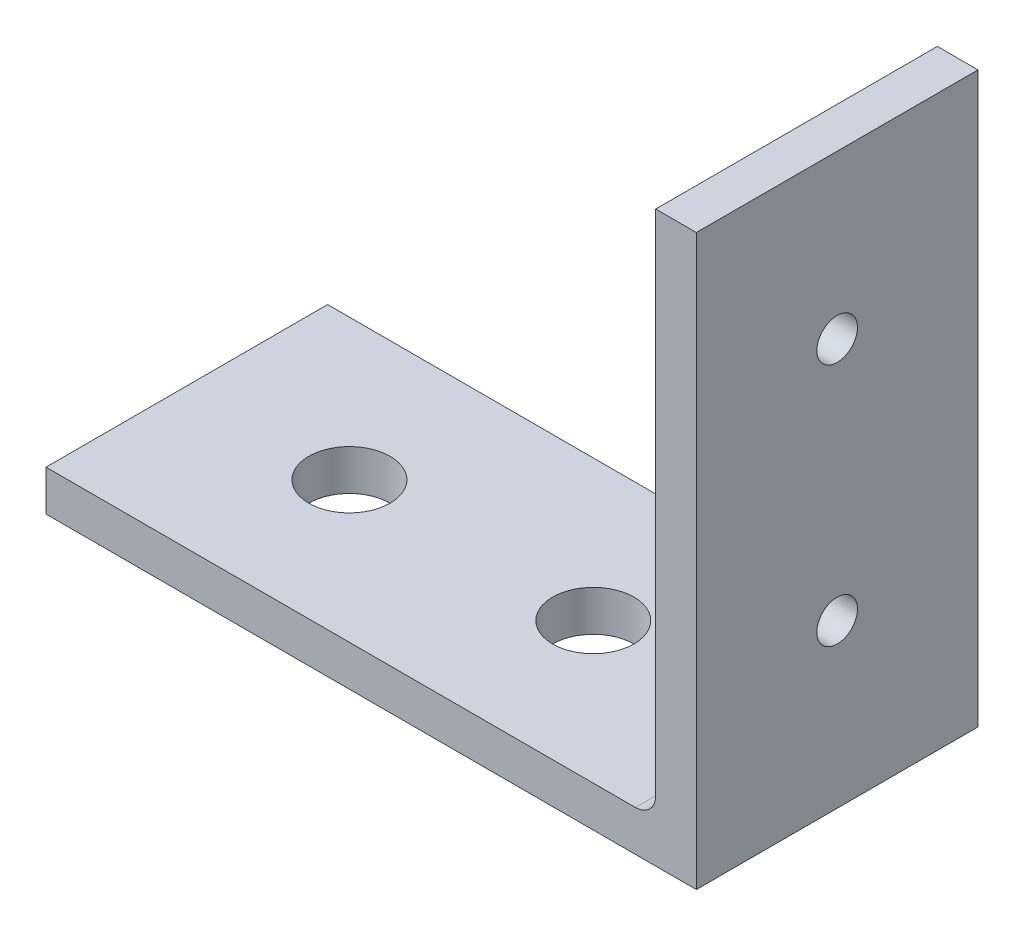
from build123d import *

# Parameters (mm, degrees)
BOSS_EXTRUDE1_DEPTH = 11
FILLET1_R           = 1.5875
SKETCH3_W           = 24.423912887
SKETCH3_H           = 26.552361768
CUT_EXTRUDE1_DEPTH  = 61.908127536
SKETCH4_R           = 3.175
CUT_EXTRUDE2_DEPTH  = 53.363751775
SKETCH5_R           = 1.5875
CUT_EXTRUDE3_DEPTH  = 69.391830652


with BuildPart() as part:
    # Sketch2 → Boss-Extrude1 (new, symmetric)
    with BuildSketch(Plane.XY):
        Polygon((-25.4, 0), (25.4, 0), (25.4, 50.8), (22.225, 50.8), (22.225, 3.175), (-25.4, 3.175), align=None)
    extrude(amount=BOSS_EXTRUDE1_DEPTH, both=True)

    # Fillet1
    fillet1_edges = [part.edges().sort_by_distance(p)[0] for p in [
        (22.225, 3.175, 0),
    ]]
    fillet(fillet1_edges, radius=FILLET1_R)

    # Sketch3 → Cut-Extrude1 (cut, through all)
    with BuildSketch(Plane.XY.offset(11)):
        with Locations((18.271034128, 57.726180884)):
            Rectangle(SKETCH3_W, SKETCH3_H)
    extrude(amount=-CUT_EXTRUDE1_DEPTH, mode=Mode.SUBTRACT)

    # Sketch4 → Cut-Extrude2 (cut, through all)
    with BuildSketch(Plane.XZ):
        with Locations((-12.7, 0)):
            Circle(SKETCH4_R)
        with Locations((6.35, 0)):
            Circle(SKETCH4_R)
    extrude(amount=-CUT_EXTRUDE2_DEPTH, mode=Mode.SUBTRACT)

    # Sketch5 → Cut-Extrude3 (cut, through all)
    with BuildSketch(Plane(origin=(25.4, 0, 0), x_dir=(0, 0, -1), z_dir=(1, 0, 0))):
        with Locations((0, 31.75)):
            Circle(SKETCH5_R)
        with Locations((0, 12.7)):
            Circle(SKETCH5_R)
    extrude(amount=-CUT_EXTRUDE3_DEPTH, mode=Mode.SUBTRACT)


solid = part.part
